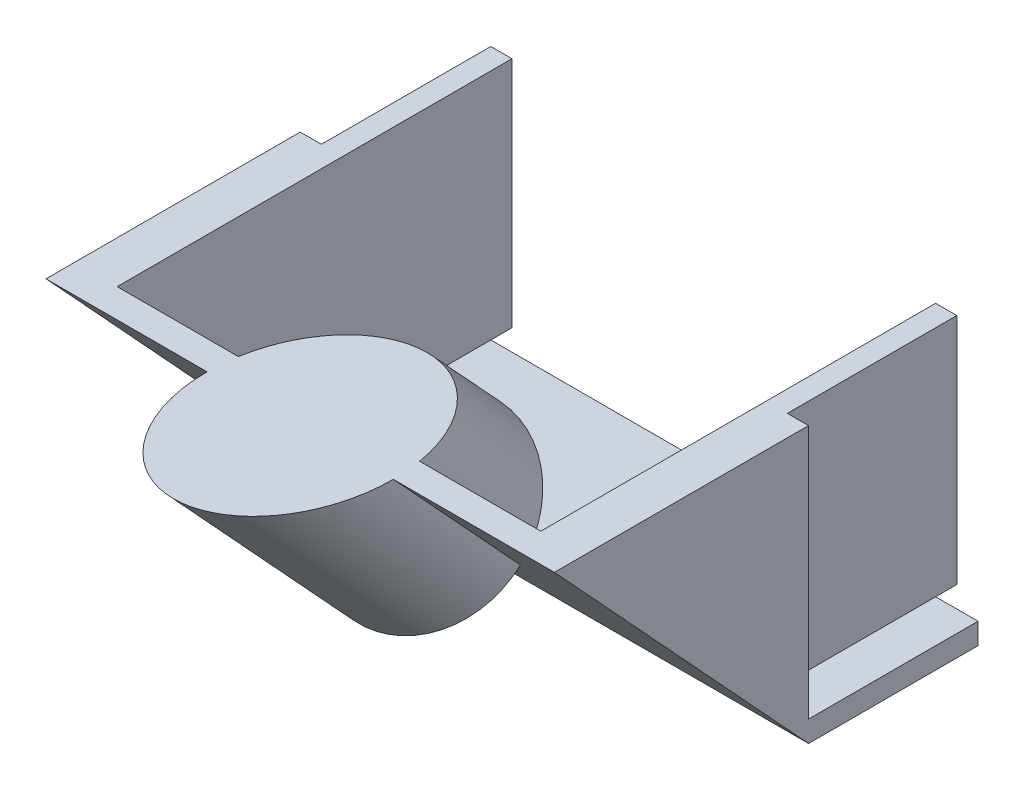
from build123d import *

# Parameters (mm, degrees)
BOSS_EXTRUDE2_DEPTH              = 76.2
BOSS_EXTRUDE2_DEPTH_BACK         = 76.2
SKETCH6_W                        = 152.4
SKETCH6_H                        = 6.35
SKETCH6_W_2                      = 6.35
SKETCH6_H_2                      = 69.85
BOSS_EXTRUDE3_DEPTH              = 50.8
CUT_EXTRUDE3_REACH               = 144.097
CUT_EXTRUDE3_OFFSET_FROM_SURFACE = 6.35
SKETCH7_W                        = 127
SKETCH7_H                        = 69.85
BOSS_EXTRUDE4_REACH              = 164.623
SKETCH8_R                        = 27.91496213


with BuildPart() as part:
    # Sketch4 → Boss-Extrude2 (new, two sides: drawn at the far end of the back side and taken through both)
    with BuildSketch(Plane(origin=(0, 0, 0), x_dir=(0, 0, -1), z_dir=(1, 0, 0)).offset(-BOSS_EXTRUDE2_DEPTH_BACK)):
        Polygon((0, 0), (0, 82.55), (-76.2, 82.55), align=None)
    extrude(amount=BOSS_EXTRUDE2_DEPTH + BOSS_EXTRUDE2_DEPTH_BACK)

    # Sketch6 → Boss-Extrude3 (add)
    with BuildSketch(Plane(origin=(0, 0, 0), x_dir=(-1, 0, 0), z_dir=(0, 0, -1))):
        with Locations((0, 3.175)):
            Rectangle(SKETCH6_W, SKETCH6_H)
        with Locations((-66.675, 47.625)):
            Rectangle(SKETCH6_W_2, SKETCH6_H_2)
        with Locations((66.675, 47.625)):
            Rectangle(SKETCH6_W_2, SKETCH6_H_2)
    extrude(amount=BOSS_EXTRUDE3_DEPTH)

    # Cut-Extrude3: up to this face of the body (flat: up to its plane, moved by the offset)
    cut_extrude3_end = Plane(part.part.faces().sort_by_distance((0, 41.275, 38.1))[0]).offset(-CUT_EXTRUDE3_OFFSET_FROM_SURFACE)
    # Sketch7 → Cut-Extrude3 (cut, up to the picked face)
    with BuildSketch(Plane(origin=(0, 0, 0), x_dir=(-1, 0, 0), z_dir=(0, 0, -1)), mode=Mode.PRIVATE) as cut_extrude3_sk1:
        with Locations((0, 47.625)):
            Rectangle(SKETCH7_W, SKETCH7_H)
    cut_extrude3_tool1 = split(extrude(cut_extrude3_sk1.sketch, amount=-CUT_EXTRUDE3_REACH, mode=Mode.PRIVATE), bisect_by=cut_extrude3_end, keep=Keep.BOTH, mode=Mode.PRIVATE)
    add(cut_extrude3_tool1.solids().sort_by(Axis((0, 47.625, 0), (0, 0, 1)))[0], mode=Mode.SUBTRACT)

    # Boss-Extrude4: up to this plane
    boss_extrude4_end = Plane(origin=(-76.2, 82.55, 0), z_dir=(0, 1, 0))
    # Sketch8 → Boss-Extrude4 (add, up to the surface)
    with BuildSketch(Plane(origin=(0, 41.275, 38.1), x_dir=(-1, 0, 0), z_dir=(0, -0.7348034446274878, -0.6782801027330659)), mode=Mode.PRIVATE) as boss_extrude4_sk1:
        Circle(SKETCH8_R)
    boss_extrude4_tool1 = split(extrude(boss_extrude4_sk1.sketch, amount=-BOSS_EXTRUDE4_REACH, mode=Mode.PRIVATE), bisect_by=boss_extrude4_end, keep=Keep.BOTH, mode=Mode.PRIVATE)
    add(boss_extrude4_tool1.solids().sort_by_distance((0, 41.275, 38.1))[0])


solid = part.part
